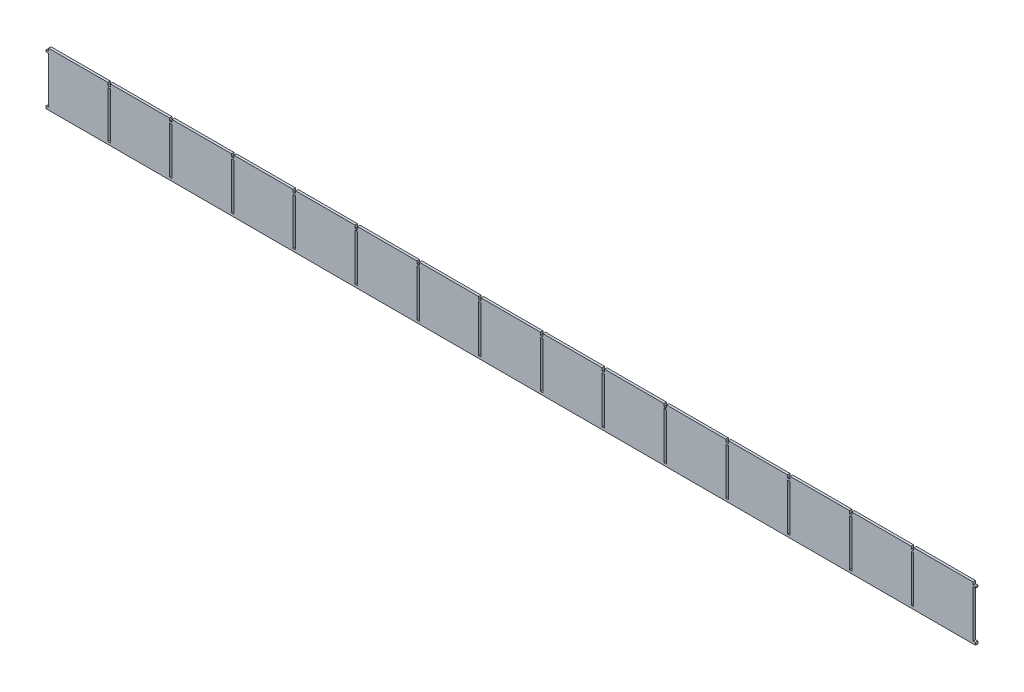
from build123d import *

# Parameters (mm, degrees)
BOSS_EXTRUDE1_DEPTH = 4


with BuildPart() as part:
    # Sketch2 → Boss-Extrude1 (new body)
    with BuildSketch(Plane.XY):
        Polygon((-748, 38.99099655), (-752, 38.99099655), (-752, 36.297950089), (-748, 36.297950089), (-748, -39.401624923), (-752, -39.401624923), (-752, -43.401624923), (752, -43.401624923), (752, -39.401624923), (748, -39.401624923), (748, 36.297950089), (752, 36.297950089), (752, 38.99099655), (748, 38.99099655), (748, 43.401624923), (652, 43.401624923), (652, 38.99099655), (650.1, 38.99099655), (650.1, 36.297950089), (652, 36.297950089), (652, -39.401624923), (648, -39.401624923), (648, 36.297950089), (649.9, 36.297950089), (649.9, 38.99099655), (648, 38.99099655), (648, 43.401624923), (552, 43.401624923), (552, 38.99099655), (550.1, 38.99099655), (550.1, 36.297950089), (552, 36.297950089), (552, -39.401624923), (548, -39.401624923), (548, 36.297950089), (549.9, 36.297950089), (549.9, 38.99099655), (548, 38.99099655), (548, 43.401624923), (452, 43.401624923), (452, 38.99099655), (450.1, 38.99099655), (450.1, 36.297950089), (452, 36.297950089), (452, -39.401624923), (448, -39.401624923), (448, 36.297950089), (449.9, 36.297950089), (449.9, 38.99099655), (448, 38.99099655), (448, 43.401624923), (352, 43.401624923), (352, 38.99099655), (350.1, 38.99099655), (350.1, 36.297950089), (352, 36.297950089), (352, -39.401624923), (350, -39.401624923), (348, -39.401624923), (348, 36.297950089), (349.9, 36.297950089), (349.9, 38.99099655), (348, 38.99099655), (348, 43.401624923), (252, 43.401624923), (252, 38.99099655), (250.1, 38.99099655), (250.1, 36.297950089), (252, 36.297950089), (252, -39.401624923), (250, -39.401624923), (248, -39.401624923), (248, 36.297950089), (249.9, 36.297950089), (249.9, 38.99099655), (248, 38.99099655), (248, 43.401624923), (152, 43.401624923), (152, 38.99099655), (150.1, 38.99099655), (150.1, 36.297950089), (152, 36.297950089), (152, -39.401624923), (148, -39.401624923), (148, 36.297950089), (149.9, 36.297950089), (149.9, 38.99099655), (148, 38.99099655), (148, 43.401624923), (52, 43.401624923), (52, 38.99099655), (50.1, 38.99099655), (50.1, 36.297950089), (52, 36.297950089), (52, -39.401624923), (48, -39.401624923), (48, 36.297950089), (49.9, 36.297950089), (49.9, 38.99099655), (48, 38.99099655), (48, 43.401624923), (-48, 43.401624923), (-48, 38.99099655), (-49.9, 38.99099655), (-49.9, 36.297950089), (-48, 36.297950089), (-48, -39.401624923), (-52, -39.401624923), (-52, 36.297950089), (-50.1, 36.297950089), (-50.1, 38.99099655), (-52, 38.99099655), (-52, 43.401624923), (-148, 43.401624923), (-148, 38.99099655), (-149.9, 38.99099655), (-149.9, 36.297950089), (-148, 36.297950089), (-148, -39.401624923), (-152, -39.401624923), (-152, 36.297950089), (-150.1, 36.297950089), (-150.1, 38.99099655), (-152, 38.99099655), (-152, 43.401624923), (-248, 43.401624923), (-248, 38.99099655), (-249.9, 38.99099655), (-249.9, 36.297950089), (-248, 36.297950089), (-248, -39.401624923), (-252, -39.401624923), (-252, 36.297950089), (-250.1, 36.297950089), (-250.1, 38.99099655), (-252, 38.99099655), (-252, 43.401624923), (-348, 43.401624923), (-348, 38.99099655), (-349.9, 38.99099655), (-349.9, 36.297950089), (-348, 36.297950089), (-348, -39.401624923), (-352, -39.401624923), (-352, 36.297950089), (-350.1, 36.297950089), (-350.1, 38.99099655), (-352, 38.99099655), (-352, 43.401624923), (-448, 43.401624923), (-448, 38.99099655), (-449.9, 38.99099655), (-449.9, 36.297950089), (-448, 36.297950089), (-448, -39.401624923), (-452, -39.401624923), (-452, 36.297950089), (-450.1, 36.297950089), (-450.1, 38.99099655), (-452, 38.99099655), (-452, 43.401624923), (-548, 43.401624923), (-548, 38.99099655), (-549.9, 38.99099655), (-549.9, 36.297950089), (-548, 36.297950089), (-548, -39.401624923), (-552, -39.401624923), (-552, 36.297950089), (-550.1, 36.297950089), (-550.1, 38.99099655), (-552, 38.99099655), (-552, 43.401624923), (-648, 43.401624923), (-648, 38.99099655), (-649.9, 38.99099655), (-649.9, 36.297950089), (-648, 36.297950089), (-648, -39.401624923), (-652, -39.401624923), (-652, 36.297950089), (-650.1, 36.297950089), (-650.1, 38.99099655), (-652, 38.99099655), (-652, 43.401624923), (-748, 43.401624923), align=None)
    extrude(amount=BOSS_EXTRUDE1_DEPTH)


solid = part.part
